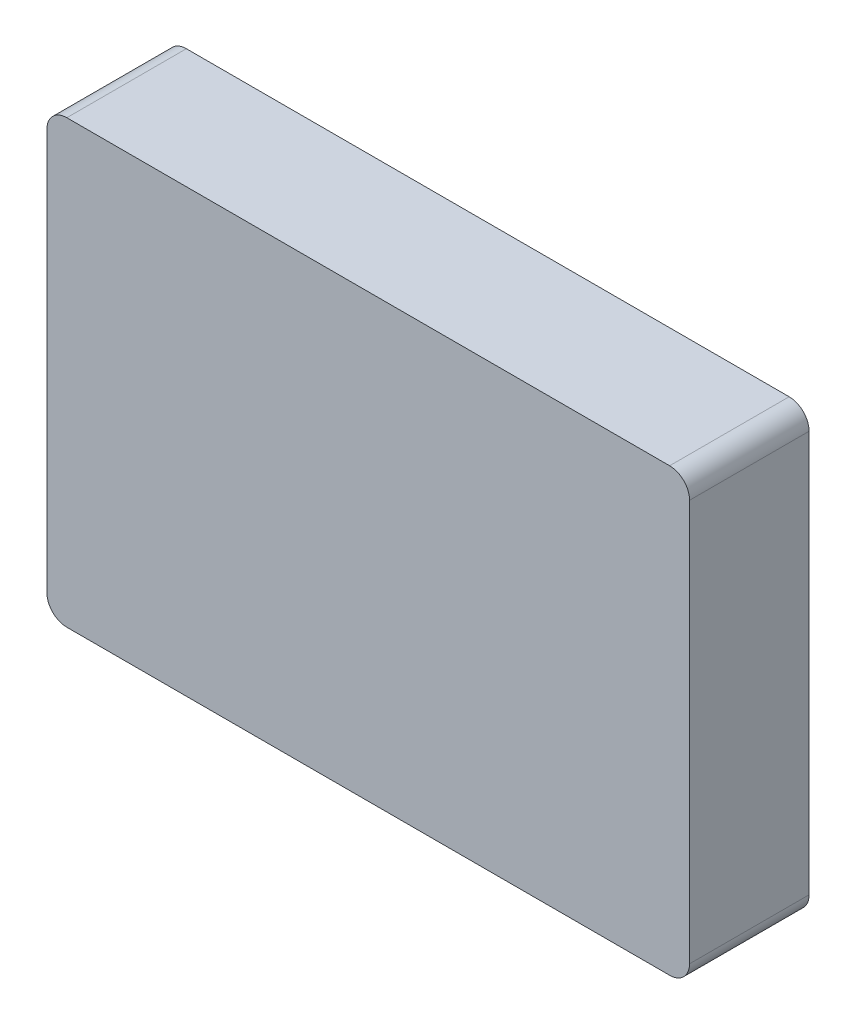
from build123d import *

# Parameters (mm, degrees)
SKETCH_1_R          = 2.5
EXTRUDE_1_DEPTH     = 2.5
EXTRUDE_1_2_DEPTH   = 2.5
EXTRUDE_1_3_DEPTH   = 2.5
SKETCH_2_R          = 1.5
EXTRUDE_2_DEPTH     = 2.5
SKETCH_3_W          = 5.060610533
SKETCH_3_H          = 13.613755096
EXTRUDE_3_DEPTH     = 2.5
SKETCH_4_W          = 80.650749302
SKETCH_4_H          = 55.377698756
EXTRUDE_4_DEPTH     = 2
SKETCH_5_W          = 80.650749302
SKETCH_5_H          = 55.377698756
SKETCH_5_W_2        = 75.650749302
SKETCH_5_H_2        = 50.377698756
EXTRUDE_5_DEPTH     = 13
FILLET_1_R          = 2.5
CUT_EXTRUDE_1_DEPTH = 2.6


with BuildPart() as part:
    # 草图1 → 凸台-拉伸1 (new body)
    with BuildSketch(Plane.XY):
        with Locations((-25.173975108, -5.08001016)):
            Circle(SKETCH_1_R)
    extrude(amount=EXTRUDE_1_DEPTH)



with BuildPart() as body_2:
    # 草图1 → Extrude 1 2 (new body)
    with BuildSketch(Plane.XY):
        with Locations((-25.173975108, -54.483108966)):
            Circle(SKETCH_1_R)
    extrude(amount=EXTRUDE_1_2_DEPTH)


with BuildPart() as body_3:
    # 草图1 → Extrude 1 3 (new body)
    with BuildSketch(Plane.XY):
        with Locations((27.94005588, -46.193418847)):
            Circle(SKETCH_1_R)
    extrude(amount=EXTRUDE_1_3_DEPTH)


with BuildPart() as part_1:
    add(part.part)

    add(body_2.part)  # 凸台-拉伸2 merges body 2

    add(body_3.part)  # 凸台-拉伸2 merges body 3
    # 草图2 → 凸台-拉伸2 (add)
    with BuildSketch(Plane(origin=(0, 0, 0), x_dir=(-1, 0, 0), z_dir=(0, 0, -1))):
        with Locations((25.173975108, -5.08001016)):
            Circle(SKETCH_2_R)
        with Locations((25.173975108, -54.483108966)):
            Circle(SKETCH_2_R)
        with Locations((-27.94005588, -46.193418847)):
            Circle(SKETCH_2_R)
    extrude(amount=EXTRUDE_2_DEPTH)



with BuildPart() as body_2_2:
    # 草图3 → 凸台-拉伸3 (new body)
    with BuildSketch(Plane(origin=(0, 0, 0), x_dir=(-1, 0, 0), z_dir=(0, 0, -1))):
        with Locations((-5.471223868, -19.889889862)):
            Rectangle(SKETCH_3_W, SKETCH_3_H)
    extrude(amount=-EXTRUDE_3_DEPTH)


with BuildPart() as part_2:
    add(part_1.part)

    add(body_2_2.part)  # 凸台-拉伸4 merges body 2 2
    # 草图4 → 凸台-拉伸4 (add)
    with BuildSketch(Plane.XY.offset(2.5)):
        with Locations((-9.398018796, -29.781559563)):
            Rectangle(SKETCH_4_W, SKETCH_4_H)
    extrude(amount=EXTRUDE_4_DEPTH)

    # 草图5 → 凸台-拉伸5 (add)
    with BuildSketch(Plane(origin=(0, 0, 2.5), x_dir=(-1, 0, 0), z_dir=(0, 0, -1))):
        with Locations((9.398018796, -29.781559563)):
            Rectangle(SKETCH_5_W, SKETCH_5_H)
        with Locations((9.398018796, -29.781559563)):
            Rectangle(SKETCH_5_W_2, SKETCH_5_H_2, mode=Mode.SUBTRACT)
    extrude(amount=EXTRUDE_5_DEPTH)

    # 圆角1
    fillet_1_edges = [part_2.edges().sort_by_distance(p)[0] for p in [
        (30.927355855, -2.092710185, -3),
        (-49.723393447, -2.092710185, -3),
        (-49.723393447, -57.470408941, -3),
        (30.927355855, -57.470408941, -3),
    ]]
    fillet(fillet_1_edges, radius=FILLET_1_R)

    # 草图7 → 切除-拉伸1 (cut)
    with BuildSketch(Plane.XZ.offset(57.470408941)):
        with BuildLine():
            Line((-1.675382515, -6.58006372), (-6.175382515, -6.58006372))
            ThreePointArc((-6.175382515, -6.58006372), (-9.675382515, -3.08006372), (-6.175382515, 0.41993628))
            Line((-6.175382515, 0.41993628), (-1.675382515, 0.41993628))
            ThreePointArc((-1.675382515, 0.41993628), (1.824617485, -3.08006372), (-1.675382515, -6.58006372))
        make_face()
    extrude(amount=-CUT_EXTRUDE_1_DEPTH, mode=Mode.SUBTRACT)


solid = part_2.part
